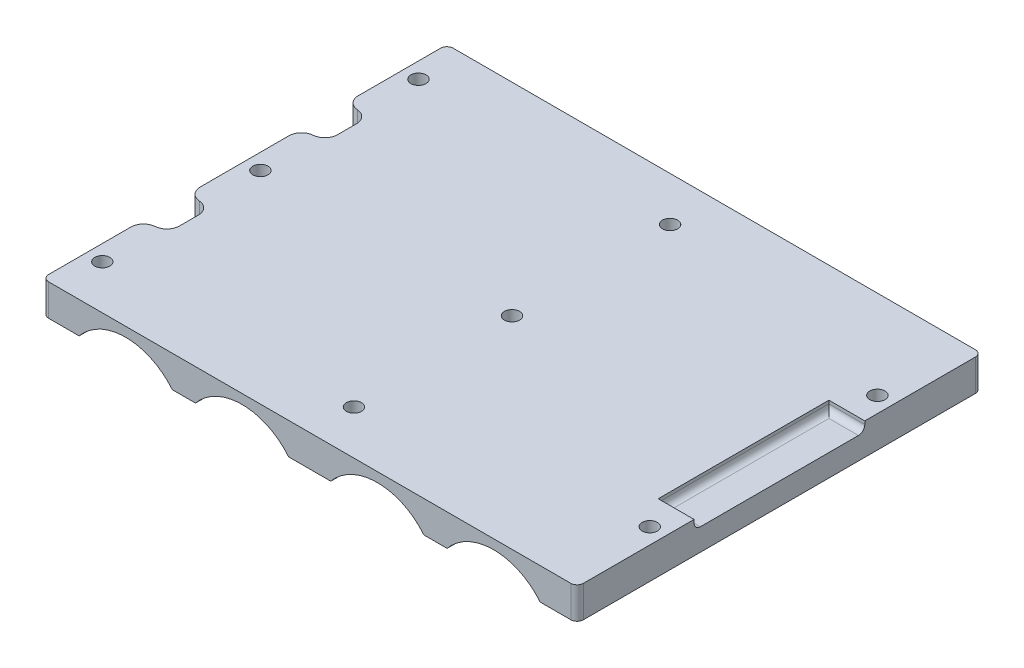
from build123d import *

# Parameters (mm, degrees)
BOSS_EXTRUDE1_DEPTH  = 32
M2_CLEARANCE_HOLE1_D = 2.4
FILLET1_R            = 1
SKETCH9_W            = 5.67
SKETCH9_H            = 27
CUT_EXTRUDE1_DEPTH   = 1.5
FILLET2_R            = 1
SKETCH11_W           = 10
SKETCH11_H           = 13
CUT_EXTRUDE3_DEPTH   = 1.5
CUT_EXTRUDE4_DEPTH   = 54.155808714
FILLET4_R            = 2


with BuildPart() as part:
    # Sketch2 → Boss-Extrude1 (new, symmetric)
    with BuildSketch(Plane.XY):
        with BuildLine():
            Line((3.334540069, -5), (-3.334540069, -5))
            ThreePointArc((-3.334540069, -5), (-10.7, -1.5), (-18.065459931, -5))
            Line((-18.065459931, -5), (-21.734540069, -5))
            ThreePointArc((-21.734540069, -5), (-29.1, -1.5), (-36.465459931, -5))
            Line((-36.465459931, -5), (-42.3, -5))
            Line((-42.3, -5), (-42.3, 0))
            Line((-42.3, 0), (42.3, 0))
            Line((42.3, 0), (42.3, -5))
            Line((42.3, -5), (36.465459931, -5))
            ThreePointArc((36.465459931, -5), (29.1, -1.5), (21.734540069, -5))
            Line((21.734540069, -5), (18.065459931, -5))
            ThreePointArc((18.065459931, -5), (10.7, -1.5), (3.334540069, -5))
        make_face()
    extrude(amount=BOSS_EXTRUDE1_DEPTH, both=True)

    # M2 Clearance Hole1 (through all)
    with Locations(Plane(origin=(0, -5, 0), x_dir=(-1, 0, 0), z_dir=(0, -1, 0))):
        with Locations((0, 25), (0, 0), (0, -25), (39.8, -25), (39.8, 0), (39.8, 25), (-39.8, -18), (-39.8, 18)):
            Hole(M2_CLEARANCE_HOLE1_D / 2)

    # Fillet1
    fillet1_edges = [part.edges().sort_by_distance(p)[0] for p in [
        (-42.3, -2.5, -32),
        (42.3, -2.5, -32),
        (-42.3, -2.5, 32),
        (42.3, -2.5, 32),
    ]]
    fillet(fillet1_edges, radius=FILLET1_R)

    # Sketch9 → Cut-Extrude1 (cut)
    with BuildSketch(Plane(origin=(0, 0, 0), x_dir=(1, 0, 0), z_dir=(0, 1, 0))):
        with Locations((39.465, 0)):
            Rectangle(SKETCH9_W, SKETCH9_H)
    extrude(amount=-CUT_EXTRUDE1_DEPTH, mode=Mode.SUBTRACT)

    # Fillet2
    fillet2_edges = [part.edges().sort_by_distance(p)[0] for p in [
        (39.465, -1.5, -13.5),
        (36.63, -1.5, 0),
        (39.465, -1.5, 13.5),
    ]]
    fillet(fillet2_edges, radius=FILLET2_R)

    # Sketch11 → Cut-Extrude3 (cut)
    with BuildSketch(Plane.XZ.offset(5)):
        with Locations((-37.3, 12.5)):
            Rectangle(SKETCH11_W, SKETCH11_H)
        with Locations((-37.3, -12.5)):
            Rectangle(SKETCH11_W, SKETCH11_H)
    extrude(amount=-CUT_EXTRUDE3_DEPTH, mode=Mode.SUBTRACT)

    # Sketch12 → Cut-Extrude4 (cut, through all)
    with BuildSketch(Plane.XZ.offset(3.5)):
        with BuildLine():
            Line((-42.3, 16), (-42.3, 9))
            Line((-42.3, 9), (-40.6, 9))
            ThreePointArc((-40.6, 9), (-39.185786438, 9.585786438), (-38.6, 11))
            Line((-38.6, 11), (-38.6, 14))
            ThreePointArc((-38.6, 14), (-39.185786438, 15.414213562), (-40.6, 16))
            Line((-40.6, 16), (-42.3, 16))
        make_face()
        with BuildLine():
            Line((-40.6, -9), (-42.3, -9))
            Line((-42.3, -9), (-42.3, -16))
            Line((-42.3, -16), (-40.6, -16))
            ThreePointArc((-40.6, -16), (-39.185786438, -15.414213562), (-38.6, -14))
            Line((-38.6, -14), (-38.6, -11))
            ThreePointArc((-38.6, -11), (-39.185786438, -9.585786438), (-40.6, -9))
        make_face()
    extrude(amount=-CUT_EXTRUDE4_DEPTH, mode=Mode.SUBTRACT)

    # Fillet4
    fillet4_edges = [part.edges().sort_by_distance(p)[0] for p in [
        (-42.3, -1.75, -16),
        (-42.3, -1.75, -9),
        (-42.3, -1.75, 9),
        (-42.3, -1.75, 16),
    ]]
    fillet(fillet4_edges, radius=FILLET4_R)


solid = part.part
